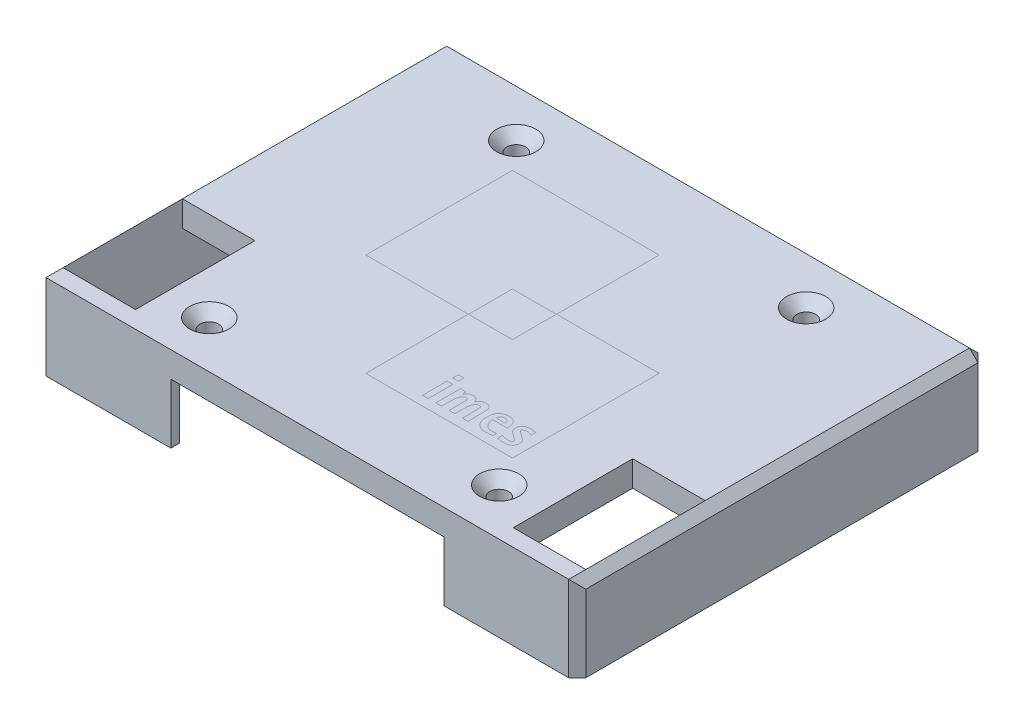
from build123d import *

# Parameters (mm, degrees)
SKETCH1_W             = 63.3
SKETCH1_H             = 48
BOSS_EXTRUDE1_DEPTH   = 3
BOSS_EXTRUDE2_DEPTH   = 7
SKETCH3_R             = 1.1
CUT_EXTRUDE1_DEPTH    = 41.960010986
CHAMFER1_SIZE         = 1.2
CHAMFER2_SIZE         = 1
SKETCH4_W             = 8.5
SKETCH4_H             = 14
CUT_EXTRUDE2_DEPTH    = 3
CUT_EXTRUDE3_DEPTH    = 0.6
BOSS_EXTRUDE3_DEPTH   = 0.6
BOSS_EXTRUDE3_2_DEPTH = 0.6
CUT_EXTRUDE4_DEPTH    = 0.6
BOSS_EXTRUDE4_DEPTH   = 0.6


with BuildPart() as part:
    # Sketch1 → Boss-Extrude1 (new body)
    with BuildSketch(Plane(origin=(0, 0, 0), x_dir=(1, 0, 0), z_dir=(0, 1, 0))):
        Rectangle(SKETCH1_W, SKETCH1_H)
    extrude(amount=BOSS_EXTRUDE1_DEPTH)

    # Sketch2 → Boss-Extrude2 (add)
    with BuildSketch(Plane.XZ):
        Polygon((-16, 24), (-16, 23), (-30.65, 23), (-30.65, -23), (30.65, -23), (30.65, 23), (16, 23), (16, 24), (31.65, 24), (31.65, -24), (-31.65, -24), (-31.65, 24), align=None)
    extrude(amount=BOSS_EXTRUDE2_DEPTH)

    # Sketch3 → Cut-Extrude1 (cut, through all)
    with BuildSketch(Plane(origin=(0, 3, 0), x_dir=(1, 0, 0), z_dir=(0, 1, 0))):
        with Locations(Location((-17, 17.5, 0), (0, 0, 270))):
            Circle(SKETCH3_R)
        with Locations(Location((17, 17.5, 0), (0, 0, 270))):
            Circle(SKETCH3_R)
        with Locations(Location((17, -18.5, 0), (0, 0, 270))):
            Circle(SKETCH3_R)
        with Locations(Location((-17, -18.5, 0), (0, 0, 270))):
            Circle(SKETCH3_R)
    extrude(amount=-CUT_EXTRUDE1_DEPTH, mode=Mode.SUBTRACT)

    # Chamfer1
    chamfer1_edges = [part.edges().sort_by_distance(p)[0] for p in [
        (-17, 3, 17.4),
        (17, 3, 17.4),
        (17, 3, -18.6),
        (-17, 3, -18.6),
    ]]
    chamfer(chamfer1_edges, length=CHAMFER1_SIZE)

    # Chamfer2
    chamfer2_edges = [part.edges().sort_by_distance(p)[0] for p in [
        (-31.65, 3, 0),
        (0, 0, -23),
        (31.65, 3, 0),
        (31.65, -2, 24),
        (-31.65, -2, 24),
        (-31.65, -2, -24),
        (31.65, -2, -24),
        (0, 3, -24),
    ]]
    chamfer(chamfer2_edges, length=CHAMFER2_SIZE)

    # Sketch4 → Cut-Extrude2 (cut)
    with BuildSketch(Plane(origin=(0, 3, 0), x_dir=(1, 0, 0), z_dir=(0, 1, 0))):
        with Locations((-26.4, -15)):
            Rectangle(SKETCH4_W, SKETCH4_H)
        with Locations((26.4, -15)):
            Rectangle(SKETCH4_W, SKETCH4_H)
    extrude(amount=-CUT_EXTRUDE2_DEPTH, mode=Mode.SUBTRACT)

    # Sketch12 → Cut-Extrude3 (cut)
    # profile 1 of 2: a face of its own
    with BuildSketch(Plane(origin=(-14.189613114, 3, 15.005108121), x_dir=(1, 0, 0), z_dir=(0, 1, 0))):
        Polygon((12.020019, 12.0491195), (12.020019, 6.0391089), (12.020019, 0.0290994), (20.6203008, 0.0290994), (29.2205815, 0.0290994), (29.2205815, 8.6293801), (29.2205815, 17.2296619), (23.2105709, 17.2296619), (17.2005603, 17.2296619), (17.2008793, 17.200557), (17.1934433, 14.6321142), (17.1860084, 12.0636758), (14.6175656, 12.0562398), (12.04912324, 12.0488038), align=None)
        Polygon((18.2483103, 4.0163695), (18.2483103, 2.5757138), (18.2483103, 1.135057), (17.9136133, 1.135057), (17.5789152, 1.135057), (17.5789152, 2.5757138), (17.5789152, 4.0163695), (17.9136133, 4.0163695), align=None, mode=Mode.SUBTRACT)
        with BuildLine():
            Line((20.6494046, 3.2841402), (20.5802652, 3.3577038))
            add(Edge.make_bspline(
                [(20.2304344, 3.4175548), (20.3773581, 3.4763421), (20.4862746, 3.4577081), (20.5802652, 3.3577038)],
                knots=[0, 0, 0, 0, 1, 1, 1, 1], degree=3))
            add(Edge.make_bspline(
                [(19.875911, 2.9540676), (19.9802526, 3.218072), (20.0897939, 3.3612821), (20.2304344, 3.4175548)],
                knots=[0, 0, 0, 0, 1, 1, 1, 1], degree=3))
            add(Edge.make_bspline(
                [(19.7968375, 1.9572498), (19.8064295, 2.741376), (19.8100903, 2.7875276), (19.875911, 2.9540676)],
                knots=[0, 0, 0, 0, 1, 1, 1, 1], degree=3))
            Line((19.7968375, 1.9572498), (19.7868275, 1.135057))
            Line((19.7868275, 1.135057), (19.4541556, 1.135057))
            Line((19.4541556, 1.135057), (19.1214826, 1.135057))
            Line((19.1214826, 1.135057), (19.1214826, 2.5757138))
            Line((19.1214826, 2.5757138), (19.1214826, 4.0163695))
            Line((19.1214826, 4.0163695), (19.4561807, 4.0163695))
            Line((19.4561807, 4.0163695), (19.7908788, 4.0163695))
            Line((19.7908788, 4.0163695), (19.7908788, 3.7923908))
            Line((19.7908788, 3.7923908), (19.7908788, 3.568411))
            Line((19.7908788, 3.568411), (19.87513, 3.7012624))
            add(Edge.make_bspline(
                [(20.8335699, 4.0297279), (20.4438641, 4.1454578), (20.0771241, 4.0197729), (19.87513, 3.7012624)],
                knots=[0, 0, 0, 0, 1, 1, 1, 1], degree=3))
            add(Edge.make_bspline(
                [(21.2356562, 3.642276), (21.167982, 3.8328169), (21.0215731, 3.9738974), (20.8335699, 4.0297279)],
                knots=[0, 0, 0, 0, 1, 1, 1, 1], degree=3))
            Line((21.2356562, 3.642276), (21.2860769, 3.5003133))
            Line((21.2860769, 3.5003133), (21.3928418, 3.6654981))
            add(Edge.make_bspline(
                [(22.207746, 4.0653063), (21.8938775, 4.1024797), (21.5737687, 3.9454283), (21.3928418, 3.6654981)],
                knots=[0, 0, 0, 0, 1, 1, 1, 1], degree=3))
            add(Edge.make_bspline(
                [(22.7943232, 3.6234638), (22.6737709, 3.8851241), (22.4768819, 4.0334316), (22.207746, 4.0653063)],
                knots=[0, 0, 0, 0, 1, 1, 1, 1], degree=3))
            add(Edge.make_bspline(
                [(22.8698844, 2.3064998), (22.8615024, 3.4589654), (22.8602814, 3.4802999), (22.7943232, 3.6234638)],
                knots=[0, 0, 0, 0, 1, 1, 1, 1], degree=3))
            Line((22.8698844, 2.3064998), (22.8783984, 1.135057))
            Line((22.8783984, 1.135057), (22.558987, 1.135057))
            Line((22.558987, 1.135057), (22.2395745, 1.135057))
            Line((22.2395745, 1.135057), (22.2303235, 2.1755316))
            add(Edge.make_bspline(
                [(22.0351912, 3.4329218), (22.2148091, 3.3585211), (22.22011, 3.3243606), (22.2303235, 2.1755316)],
                knots=[0, 0, 0, 0, 1, 1, 1, 1], degree=3))
            add(Edge.make_bspline(
                [(21.4802027, 3.0815752), (21.5972493, 3.3536558), (21.8461474, 3.5112264), (22.0351912, 3.4329218)],
                knots=[0, 0, 0, 0, 1, 1, 1, 1], degree=3))
            add(Edge.make_bspline(
                [(21.3339016, 1.8408335), (21.3344516, 2.5902239), (21.3592126, 2.8003239), (21.4802027, 3.0815752)],
                knots=[0, 0, 0, 0, 1, 1, 1, 1], degree=3))
            Line((21.3339016, 1.8408335), (21.3333516, 1.135057))
            Line((21.3333516, 1.135057), (20.9996776, 1.135057))
            Line((20.9996776, 1.135057), (20.6660036, 1.135057))
            Line((20.6660036, 1.135057), (20.6577096, 2.2095986))
            Line((20.6577096, 2.2095986), (20.6494046, 3.2841402))
        make_face(mode=Mode.SUBTRACT)
        Polygon((18.2483103, 5.2969532), (18.2483103, 4.976807), (18.2483103, 4.6566619), (17.9136133, 4.6566619), (17.5789152, 4.6566619), (17.5789152, 4.976807), (17.5789152, 5.2969532), (17.9136133, 5.2969532), align=None, mode=Mode.SUBTRACT)
        with BuildLine():
            Line((25.7862902, 1.1688754), (25.7388868, 1.153224307))
            Line((25.7388868, 1.153224307), (25.6479949, 1.1354486))
            add(Edge.make_bspline(
                [(24.5378056, 1.121131), (24.7198875, 1.0701064), (25.4148257, 1.0790681), (25.6479949, 1.1354486)],
                knots=[0, 0, 0, 0, 1, 1, 1, 1], degree=3))
            add(Edge.make_bspline(
                [(23.6125945, 2.1245994), (23.7540468, 1.5950308), (24.0701626, 1.2521773), (24.5378056, 1.121131)],
                knots=[0, 0, 0, 0, 1, 1, 1, 1], degree=3))
            add(Edge.make_bspline(
                [(23.6255052, 3.3086592), (23.5400627, 3.0369053), (23.5333494, 2.4212771), (23.6125945, 2.1245994)],
                knots=[0, 0, 0, 0, 1, 1, 1, 1], degree=3))
            add(Edge.make_bspline(
                [(24.0063824, 3.8624817), (23.8219025, 3.7217741), (23.6993779, 3.5436159), (23.6255052, 3.3086592)],
                knots=[0, 0, 0, 0, 1, 1, 1, 1], degree=3))
            add(Edge.make_bspline(
                [(24.7821453, 4.0590902), (24.4064755, 4.0601902), (24.1954856, 4.0067159), (24.0063824, 3.8624817)],
                knots=[0, 0, 0, 0, 1, 1, 1, 1], degree=3))
            add(Edge.make_bspline(
                [(25.2769165, 3.9775318), (25.1202215, 4.0498755), (25.0694202, 4.0582498), (24.7821453, 4.0590902)],
                knots=[0, 0, 0, 0, 1, 1, 1, 1], degree=3))
            add(Edge.make_bspline(
                [(25.5583251, 3.7929617), (25.4995939, 3.8501342), (25.3729597, 3.9331908), (25.2769165, 3.9775318)],
                knots=[0, 0, 0, 0, 1, 1, 1, 1], degree=3))
            add(Edge.make_bspline(
                [(25.8733827, 2.8885835), (25.8729427, 3.2391678), (25.7424057, 3.6137684), (25.5583251, 3.7929617)],
                knots=[0, 0, 0, 0, 1, 1, 1, 1], degree=3))
            Line((25.8733827, 2.8885835), (25.8736027, 2.7648907))
            Line((25.8736027, 2.7648907), (25.0286685, 2.7648907))
            add(Edge.make_bspline(
                [(24.1822086, 2.5093387), (24.1272713, 2.7828889), (24.0676579, 2.7648907), (25.0286685, 2.7648907)],
                knots=[0, 0, 0, 0, 1, 1, 1, 1], degree=3))
            add(Edge.make_bspline(
                [(24.7718526, 1.6448091), (24.4880471, 1.7994394), (24.2566368, 2.13873), (24.1822086, 2.5093387)],
                knots=[0, 0, 0, 0, 1, 1, 1, 1], degree=3))
            add(Edge.make_bspline(
                [(25.1820283, 1.5476582), (24.9700792, 1.5578552), (24.9017538, 1.5740318), (24.7718526, 1.6448091)],
                knots=[0, 0, 0, 0, 1, 1, 1, 1], degree=3))
            add(Edge.make_bspline(
                [(25.7388868, 1.6178657), (25.5870384, 1.5595954), (25.4066736, 1.5368551), (25.1820283, 1.5476582)],
                knots=[0, 0, 0, 0, 1, 1, 1, 1], degree=3))
            add(Edge.make_bspline(
                [(25.7862902, 1.4024659), (25.7862902, 1.6063509), (25.7802622, 1.6337431), (25.7388868, 1.6178657)],
                knots=[0, 0, 0, 0, 1, 1, 1, 1], degree=3))
            Line((25.7862902, 1.4024659), (25.7862902, 1.1688754))
        make_face(mode=Mode.SUBTRACT)
        with BuildLine():
            Line((27.9982065, 3.9818856), (27.9982065, 3.7080857))
            add(Edge.make_bspline(
                [(27.9871196, 3.4342869), (27.9932136, 3.4342869), (27.9982065, 3.5574957), (27.9982065, 3.7080857)],
                knots=[0, 0, 0, 0, 1, 1, 1, 1], degree=3))
            add(Edge.make_bspline(
                [(27.7906662, 3.5036375), (27.8926175, 3.465495), (27.9810212, 3.4342869), (27.9871196, 3.4342869)],
                knots=[0, 0, 0, 0, 1, 1, 1, 1], degree=3))
            add(Edge.make_bspline(
                [(27.4807643, 3.5936516), (27.5492591, 3.5822875), (27.6887149, 3.5417811), (27.7906662, 3.5036375)],
                knots=[0, 0, 0, 0, 1, 1, 1, 1], degree=3))
            add(Edge.make_bspline(
                [(26.9213527, 3.3377366), (26.9213527, 3.4972828), (27.2248273, 3.6361138), (27.4807643, 3.5936516)],
                knots=[0, 0, 0, 0, 1, 1, 1, 1], degree=3))
            add(Edge.make_bspline(
                [(27.4574696, 2.839353), (27.0306883, 3.1179929), (26.9213527, 3.2196329), (26.9213527, 3.3377366)],
                knots=[0, 0, 0, 0, 1, 1, 1, 1], degree=3))
            add(Edge.make_bspline(
                [(28.1719075, 1.9063176), (28.1712475, 2.2900262), (28.0436662, 2.4566322), (27.4574696, 2.839353)],
                knots=[0, 0, 0, 0, 1, 1, 1, 1], degree=3))
            add(Edge.make_bspline(
                [(27.5179883, 1.116313), (27.9551316, 1.232803), (28.1726236, 1.4955556), (28.1719075, 1.9063176)],
                knots=[0, 0, 0, 0, 1, 1, 1, 1], degree=3))
            add(Edge.make_bspline(
                [(26.5866546, 1.121076), (26.8147605, 1.0696763), (27.3330189, 1.0670286), (27.5179883, 1.116313)],
                knots=[0, 0, 0, 0, 1, 1, 1, 1], degree=3))
            add(Edge.make_bspline(
                [(26.3756493, 1.162293), (26.3956583, 1.161303), (26.4906103, 1.1427174), (26.5866546, 1.121076)],
                knots=[0, 0, 0, 0, 1, 1, 1, 1], degree=3))
            add(Edge.make_bspline(
                [(26.339269, 1.4583173), (26.339269, 1.2433916), (26.34907, 1.1636581), (26.3756493, 1.162293)],
                knots=[0, 0, 0, 0, 1, 1, 1, 1], degree=3))
            add(Edge.make_bspline(
                [(26.3902012, 1.7311701), (26.3436492, 1.7506401), (26.339269, 1.7271771), (26.339269, 1.4583173)],
                knots=[0, 0, 0, 0, 1, 1, 1, 1], degree=3))
            add(Edge.make_bspline(
                [(27.561644, 1.8363917), (27.561644, 1.5487208), (26.9564108, 1.4943577), (26.3902012, 1.7311701)],
                knots=[0, 0, 0, 0, 1, 1, 1, 1], degree=3))
            add(Edge.make_bspline(
                [(27.0386424, 2.3289266), (27.451072, 2.0493957), (27.561644, 1.9452653), (27.561644, 1.8363917)],
                knots=[0, 0, 0, 0, 1, 1, 1, 1], degree=3))
            add(Edge.make_bspline(
                [(26.340193, 3.2596619), (26.340853, 2.9035061), (26.4960916, 2.6966511), (27.0386424, 2.3289266)],
                knots=[0, 0, 0, 0, 1, 1, 1, 1], degree=3))
            add(Edge.make_bspline(
                [(27.7187284, 4.0322062), (26.9019795, 4.1792652), (26.3390589, 3.8637995), (26.340193, 3.2596619)],
                knots=[0, 0, 0, 0, 1, 1, 1, 1], degree=3))
            Line((27.7187284, 4.0322062), (27.9982065, 3.9818856))
        make_face(mode=Mode.SUBTRACT)
    # profile 2 of 2: a face of its own
    with BuildSketch(Plane(origin=(-14.189613114, 3, 15.005108121), x_dir=(1, 0, 0), z_dir=(0, 1, 0))):
        with BuildLine():
            Line((25.2409751, 3.1432445), (25.2255432, 3.258299))
            add(Edge.make_bspline(
                [(24.3700204, 3.5135529), (24.6848503, 3.7899774), (25.173797, 3.6440943), (25.2255432, 3.258299)],
                knots=[0, 0, 0, 0, 1, 1, 1, 1], degree=3))
            add(Edge.make_bspline(
                [(24.1855603, 3.1878363), (24.1855603, 3.2789581), (24.2673794, 3.4234332), (24.3700204, 3.5135529)],
                knots=[0, 0, 0, 0, 1, 1, 1, 1], degree=3))
            add(Edge.make_bspline(
                [(24.7132677, 3.1432445), (24.2586806, 3.1432445), (24.1855603, 3.1494265), (24.1855603, 3.1878363)],
                knots=[0, 0, 0, 0, 1, 1, 1, 1], degree=3))
            Line((24.7132677, 3.1432445), (25.2409751, 3.1432445))
        make_face()
    extrude(amount=-CUT_EXTRUDE3_DEPTH, mode=Mode.SUBTRACT)

    # Sketch12<5> → Cut-Extrude4 (cut)
    with BuildSketch(Plane(origin=(-14.189613114, 3, 15.005108121), x_dir=(1, 0, 0), z_dir=(0, 1, 0))):
        Polygon((17.2005603, 17.2296619), (17.2008793, 17.200557), (14.6250005, 17.200557), (12.04912324, 17.200557), (12.04912324, 14.6246804), (12.04912324, 12.0488038), (12.020019, 12.0491195), (6.01000862, 12.0491195), (-1.76e-06, 12.0491195), (-1.76e-06, 20.64940108), (-1.76e-06, 29.24968233), (8.60027949, 29.24968233), (17.2005603, 29.24968233), (17.2005603, 23.23967184), align=None)
    extrude(amount=-CUT_EXTRUDE4_DEPTH, mode=Mode.SUBTRACT)


with BuildPart() as body_2:
    # Sketch12<4> → Boss-Extrude3 (new body)
    with BuildSketch(Plane(origin=(-14.189613114, 3, 15.005108121), x_dir=(1, 0, 0), z_dir=(0, 1, 0))):
        Polygon((12.020019, 12.0491195), (12.020019, 6.0391089), (12.020019, 0.0290994), (20.6203008, 0.0290994), (29.2205815, 0.0290994), (29.2205815, 8.6293801), (29.2205815, 17.2296619), (23.2105709, 17.2296619), (17.2005603, 17.2296619), (17.2008793, 17.200557), (17.1934433, 14.6321142), (17.1860084, 12.0636758), (14.6175656, 12.0562398), (12.04912324, 12.0488038), align=None)
        Polygon((18.2483103, 4.0163695), (18.2483103, 2.5757138), (18.2483103, 1.135057), (17.9136133, 1.135057), (17.5789152, 1.135057), (17.5789152, 2.5757138), (17.5789152, 4.0163695), (17.9136133, 4.0163695), align=None, mode=Mode.SUBTRACT)
        with BuildLine():
            Line((20.6494046, 3.2841402), (20.5802652, 3.3577038))
            add(Edge.make_bspline(
                [(20.2304344, 3.4175548), (20.3773581, 3.4763421), (20.4862746, 3.4577081), (20.5802652, 3.3577038)],
                knots=[0, 0, 0, 0, 1, 1, 1, 1], degree=3))
            add(Edge.make_bspline(
                [(19.875911, 2.9540676), (19.9802526, 3.218072), (20.0897939, 3.3612821), (20.2304344, 3.4175548)],
                knots=[0, 0, 0, 0, 1, 1, 1, 1], degree=3))
            add(Edge.make_bspline(
                [(19.7968375, 1.9572498), (19.8064295, 2.741376), (19.8100903, 2.7875276), (19.875911, 2.9540676)],
                knots=[0, 0, 0, 0, 1, 1, 1, 1], degree=3))
            Line((19.7968375, 1.9572498), (19.7868275, 1.135057))
            Line((19.7868275, 1.135057), (19.4541556, 1.135057))
            Line((19.4541556, 1.135057), (19.1214826, 1.135057))
            Line((19.1214826, 1.135057), (19.1214826, 2.5757138))
            Line((19.1214826, 2.5757138), (19.1214826, 4.0163695))
            Line((19.1214826, 4.0163695), (19.4561807, 4.0163695))
            Line((19.4561807, 4.0163695), (19.7908788, 4.0163695))
            Line((19.7908788, 4.0163695), (19.7908788, 3.7923908))
            Line((19.7908788, 3.7923908), (19.7908788, 3.568411))
            Line((19.7908788, 3.568411), (19.87513, 3.7012624))
            add(Edge.make_bspline(
                [(20.8335699, 4.0297279), (20.4438641, 4.1454578), (20.0771241, 4.0197729), (19.87513, 3.7012624)],
                knots=[0, 0, 0, 0, 1, 1, 1, 1], degree=3))
            add(Edge.make_bspline(
                [(21.2356562, 3.642276), (21.167982, 3.8328169), (21.0215731, 3.9738974), (20.8335699, 4.0297279)],
                knots=[0, 0, 0, 0, 1, 1, 1, 1], degree=3))
            Line((21.2356562, 3.642276), (21.2860769, 3.5003133))
            Line((21.2860769, 3.5003133), (21.3928418, 3.6654981))
            add(Edge.make_bspline(
                [(22.207746, 4.0653063), (21.8938775, 4.1024797), (21.5737687, 3.9454283), (21.3928418, 3.6654981)],
                knots=[0, 0, 0, 0, 1, 1, 1, 1], degree=3))
            add(Edge.make_bspline(
                [(22.7943232, 3.6234638), (22.6737709, 3.8851241), (22.4768819, 4.0334316), (22.207746, 4.0653063)],
                knots=[0, 0, 0, 0, 1, 1, 1, 1], degree=3))
            add(Edge.make_bspline(
                [(22.8698844, 2.3064998), (22.8615024, 3.4589654), (22.8602814, 3.4802999), (22.7943232, 3.6234638)],
                knots=[0, 0, 0, 0, 1, 1, 1, 1], degree=3))
            Line((22.8698844, 2.3064998), (22.8783984, 1.135057))
            Line((22.8783984, 1.135057), (22.558987, 1.135057))
            Line((22.558987, 1.135057), (22.2395745, 1.135057))
            Line((22.2395745, 1.135057), (22.2303235, 2.1755316))
            add(Edge.make_bspline(
                [(22.0351912, 3.4329218), (22.2148091, 3.3585211), (22.22011, 3.3243606), (22.2303235, 2.1755316)],
                knots=[0, 0, 0, 0, 1, 1, 1, 1], degree=3))
            add(Edge.make_bspline(
                [(21.4802027, 3.0815752), (21.5972493, 3.3536558), (21.8461474, 3.5112264), (22.0351912, 3.4329218)],
                knots=[0, 0, 0, 0, 1, 1, 1, 1], degree=3))
            add(Edge.make_bspline(
                [(21.3339016, 1.8408335), (21.3344516, 2.5902239), (21.3592126, 2.8003239), (21.4802027, 3.0815752)],
                knots=[0, 0, 0, 0, 1, 1, 1, 1], degree=3))
            Line((21.3339016, 1.8408335), (21.3333516, 1.135057))
            Line((21.3333516, 1.135057), (20.9996776, 1.135057))
            Line((20.9996776, 1.135057), (20.6660036, 1.135057))
            Line((20.6660036, 1.135057), (20.6577096, 2.2095986))
            Line((20.6577096, 2.2095986), (20.6494046, 3.2841402))
        make_face(mode=Mode.SUBTRACT)
        Polygon((18.2483103, 5.2969532), (18.2483103, 4.976807), (18.2483103, 4.6566619), (17.9136133, 4.6566619), (17.5789152, 4.6566619), (17.5789152, 4.976807), (17.5789152, 5.2969532), (17.9136133, 5.2969532), align=None, mode=Mode.SUBTRACT)
        with BuildLine():
            Line((25.7862902, 1.1688754), (25.7388868, 1.153224307))
            Line((25.7388868, 1.153224307), (25.6479949, 1.1354486))
            add(Edge.make_bspline(
                [(24.5378056, 1.121131), (24.7198875, 1.0701064), (25.4148257, 1.0790681), (25.6479949, 1.1354486)],
                knots=[0, 0, 0, 0, 1, 1, 1, 1], degree=3))
            add(Edge.make_bspline(
                [(23.6125945, 2.1245994), (23.7540468, 1.5950308), (24.0701626, 1.2521773), (24.5378056, 1.121131)],
                knots=[0, 0, 0, 0, 1, 1, 1, 1], degree=3))
            add(Edge.make_bspline(
                [(23.6255052, 3.3086592), (23.5400627, 3.0369053), (23.5333494, 2.4212771), (23.6125945, 2.1245994)],
                knots=[0, 0, 0, 0, 1, 1, 1, 1], degree=3))
            add(Edge.make_bspline(
                [(24.0063824, 3.8624817), (23.8219025, 3.7217741), (23.6993779, 3.5436159), (23.6255052, 3.3086592)],
                knots=[0, 0, 0, 0, 1, 1, 1, 1], degree=3))
            add(Edge.make_bspline(
                [(24.7821453, 4.0590902), (24.4064755, 4.0601902), (24.1954856, 4.0067159), (24.0063824, 3.8624817)],
                knots=[0, 0, 0, 0, 1, 1, 1, 1], degree=3))
            add(Edge.make_bspline(
                [(25.2769165, 3.9775318), (25.1202215, 4.0498755), (25.0694202, 4.0582498), (24.7821453, 4.0590902)],
                knots=[0, 0, 0, 0, 1, 1, 1, 1], degree=3))
            add(Edge.make_bspline(
                [(25.5583251, 3.7929617), (25.4995939, 3.8501342), (25.3729597, 3.9331908), (25.2769165, 3.9775318)],
                knots=[0, 0, 0, 0, 1, 1, 1, 1], degree=3))
            add(Edge.make_bspline(
                [(25.8733827, 2.8885835), (25.8729427, 3.2391678), (25.7424057, 3.6137684), (25.5583251, 3.7929617)],
                knots=[0, 0, 0, 0, 1, 1, 1, 1], degree=3))
            Line((25.8733827, 2.8885835), (25.8736027, 2.7648907))
            Line((25.8736027, 2.7648907), (25.0286685, 2.7648907))
            add(Edge.make_bspline(
                [(24.1822086, 2.5093387), (24.1272713, 2.7828889), (24.0676579, 2.7648907), (25.0286685, 2.7648907)],
                knots=[0, 0, 0, 0, 1, 1, 1, 1], degree=3))
            add(Edge.make_bspline(
                [(24.7718526, 1.6448091), (24.4880471, 1.7994394), (24.2566368, 2.13873), (24.1822086, 2.5093387)],
                knots=[0, 0, 0, 0, 1, 1, 1, 1], degree=3))
            add(Edge.make_bspline(
                [(25.1820283, 1.5476582), (24.9700792, 1.5578552), (24.9017538, 1.5740318), (24.7718526, 1.6448091)],
                knots=[0, 0, 0, 0, 1, 1, 1, 1], degree=3))
            add(Edge.make_bspline(
                [(25.7388868, 1.6178657), (25.5870384, 1.5595954), (25.4066736, 1.5368551), (25.1820283, 1.5476582)],
                knots=[0, 0, 0, 0, 1, 1, 1, 1], degree=3))
            add(Edge.make_bspline(
                [(25.7862902, 1.4024659), (25.7862902, 1.6063509), (25.7802622, 1.6337431), (25.7388868, 1.6178657)],
                knots=[0, 0, 0, 0, 1, 1, 1, 1], degree=3))
            Line((25.7862902, 1.4024659), (25.7862902, 1.1688754))
        make_face(mode=Mode.SUBTRACT)
        with BuildLine():
            Line((27.9982065, 3.9818856), (27.9982065, 3.7080857))
            add(Edge.make_bspline(
                [(27.9871196, 3.4342869), (27.9932136, 3.4342869), (27.9982065, 3.5574957), (27.9982065, 3.7080857)],
                knots=[0, 0, 0, 0, 1, 1, 1, 1], degree=3))
            add(Edge.make_bspline(
                [(27.7906662, 3.5036375), (27.8926175, 3.465495), (27.9810212, 3.4342869), (27.9871196, 3.4342869)],
                knots=[0, 0, 0, 0, 1, 1, 1, 1], degree=3))
            add(Edge.make_bspline(
                [(27.4807643, 3.5936516), (27.5492591, 3.5822875), (27.6887149, 3.5417811), (27.7906662, 3.5036375)],
                knots=[0, 0, 0, 0, 1, 1, 1, 1], degree=3))
            add(Edge.make_bspline(
                [(26.9213527, 3.3377366), (26.9213527, 3.4972828), (27.2248273, 3.6361138), (27.4807643, 3.5936516)],
                knots=[0, 0, 0, 0, 1, 1, 1, 1], degree=3))
            add(Edge.make_bspline(
                [(27.4574696, 2.839353), (27.0306883, 3.1179929), (26.9213527, 3.2196329), (26.9213527, 3.3377366)],
                knots=[0, 0, 0, 0, 1, 1, 1, 1], degree=3))
            add(Edge.make_bspline(
                [(28.1719075, 1.9063176), (28.1712475, 2.2900262), (28.0436662, 2.4566322), (27.4574696, 2.839353)],
                knots=[0, 0, 0, 0, 1, 1, 1, 1], degree=3))
            add(Edge.make_bspline(
                [(27.5179883, 1.116313), (27.9551316, 1.232803), (28.1726236, 1.4955556), (28.1719075, 1.9063176)],
                knots=[0, 0, 0, 0, 1, 1, 1, 1], degree=3))
            add(Edge.make_bspline(
                [(26.5866546, 1.121076), (26.8147605, 1.0696763), (27.3330189, 1.0670286), (27.5179883, 1.116313)],
                knots=[0, 0, 0, 0, 1, 1, 1, 1], degree=3))
            add(Edge.make_bspline(
                [(26.3756493, 1.162293), (26.3956583, 1.161303), (26.4906103, 1.1427174), (26.5866546, 1.121076)],
                knots=[0, 0, 0, 0, 1, 1, 1, 1], degree=3))
            add(Edge.make_bspline(
                [(26.339269, 1.4583173), (26.339269, 1.2433916), (26.34907, 1.1636581), (26.3756493, 1.162293)],
                knots=[0, 0, 0, 0, 1, 1, 1, 1], degree=3))
            add(Edge.make_bspline(
                [(26.3902012, 1.7311701), (26.3436492, 1.7506401), (26.339269, 1.7271771), (26.339269, 1.4583173)],
                knots=[0, 0, 0, 0, 1, 1, 1, 1], degree=3))
            add(Edge.make_bspline(
                [(27.561644, 1.8363917), (27.561644, 1.5487208), (26.9564108, 1.4943577), (26.3902012, 1.7311701)],
                knots=[0, 0, 0, 0, 1, 1, 1, 1], degree=3))
            add(Edge.make_bspline(
                [(27.0386424, 2.3289266), (27.451072, 2.0493957), (27.561644, 1.9452653), (27.561644, 1.8363917)],
                knots=[0, 0, 0, 0, 1, 1, 1, 1], degree=3))
            add(Edge.make_bspline(
                [(26.340193, 3.2596619), (26.340853, 2.9035061), (26.4960916, 2.6966511), (27.0386424, 2.3289266)],
                knots=[0, 0, 0, 0, 1, 1, 1, 1], degree=3))
            add(Edge.make_bspline(
                [(27.7187284, 4.0322062), (26.9019795, 4.1792652), (26.3390589, 3.8637995), (26.340193, 3.2596619)],
                knots=[0, 0, 0, 0, 1, 1, 1, 1], degree=3))
            Line((27.7187284, 4.0322062), (27.9982065, 3.9818856))
        make_face(mode=Mode.SUBTRACT)
    extrude(amount=-BOSS_EXTRUDE3_DEPTH)


with BuildPart() as body_3:
    # Sketch12<4> → Boss-Extrude3 2 (new body)
    with BuildSketch(Plane(origin=(-14.189613114, 3, 15.005108121), x_dir=(1, 0, 0), z_dir=(0, 1, 0))):
        with BuildLine():
            Line((25.2409751, 3.1432445), (25.2255432, 3.258299))
            add(Edge.make_bspline(
                [(24.3700204, 3.5135529), (24.6848503, 3.7899774), (25.173797, 3.6440943), (25.2255432, 3.258299)],
                knots=[0, 0, 0, 0, 1, 1, 1, 1], degree=3))
            add(Edge.make_bspline(
                [(24.1855603, 3.1878363), (24.1855603, 3.2789581), (24.2673794, 3.4234332), (24.3700204, 3.5135529)],
                knots=[0, 0, 0, 0, 1, 1, 1, 1], degree=3))
            add(Edge.make_bspline(
                [(24.7132677, 3.1432445), (24.2586806, 3.1432445), (24.1855603, 3.1494265), (24.1855603, 3.1878363)],
                knots=[0, 0, 0, 0, 1, 1, 1, 1], degree=3))
            Line((24.7132677, 3.1432445), (25.2409751, 3.1432445))
        make_face()
    extrude(amount=-BOSS_EXTRUDE3_2_DEPTH)


with BuildPart() as body_4:
    # Sketch12<6> → Boss-Extrude4 (new body)
    with BuildSketch(Plane(origin=(-14.189613114, 3, 15.005108121), x_dir=(1, 0, 0), z_dir=(0, 1, 0))):
        Polygon((17.2005603, 17.2296619), (17.2008793, 17.200557), (14.6250005, 17.200557), (12.04912324, 17.200557), (12.04912324, 14.6246804), (12.04912324, 12.0488038), (12.020019, 12.0491195), (6.01000862, 12.0491195), (-1.76e-06, 12.0491195), (-1.76e-06, 20.64940108), (-1.76e-06, 29.24968233), (8.60027949, 29.24968233), (17.2005603, 29.24968233), (17.2005603, 23.23967184), align=None)
    extrude(amount=-BOSS_EXTRUDE4_DEPTH)


solid = Compound([part.part, body_2.part, body_3.part, body_4.part])
